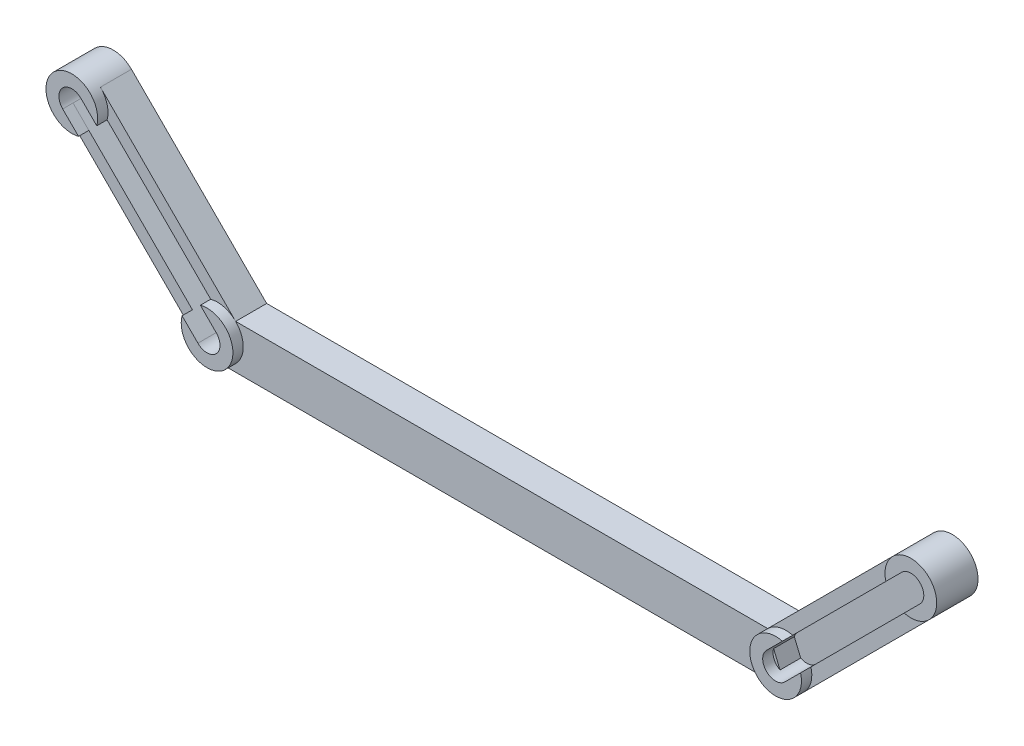
from build123d import *
from build123d.topology import SkipClean

# Parameters (mm, degrees)
SKETCH_1_R            = 5
SKETCH_1_R_2          = 2.5
EXTRUDE_1_DEPTH       = 10
EXTRUDE_1_2_DEPTH     = 10
EXTRUDE_1_3_DEPTH     = 10
EXTRUDE_1_4_DEPTH     = 10
EXTRUDE_2_DEPTH       = 6
CUT_EXTRUDE_1_DEPTH   = 4
EXTRUDE_START         = -2
EXTRUDE_3_OUTLINE_R   = 2.5
EXTRUDE_3_DEPTH       = 2
EXTRUDE_3_2_DEPTH     = 2
EXTRUDE_3_3_OUTLINE_R = 2.5
EXTRUDE_3_3_DEPTH     = 2
CUT_EXTRUDE_2_DEPTH   = 4
CUT_EXTRUDE_6_DEPTH   = 8
EXTRUDE_4_DEPTH       = 6
CUT_EXTRUDE_START     = -2
CUT_EXTRUDE_8_DEPTH   = 2
CUT_EXTRUDE_8_2_DEPTH = 2


with BuildPart() as part:
    # Эскиз1 → Бобышка-Вытянуть1 (new body)
    with BuildSketch(Plane.XY):
        with Locations((-11.277859903, 1.201925786)):
            Circle(SKETCH_1_R)
        with Locations((-11.277859903, 1.201925786)):
            Circle(SKETCH_1_R_2, mode=Mode.SUBTRACT)
    extrude(amount=EXTRUDE_1_DEPTH)



with BuildPart() as body_2:
    # Эскиз1 → Extrude 1 2 (new body)
    with BuildSketch(Plane.XY):
        with Locations((-37.440810807, -24.961025118)):
            Circle(SKETCH_1_R)
        with Locations((-37.440810807, -24.961025118)):
            Circle(SKETCH_1_R_2, mode=Mode.SUBTRACT)
    extrude(amount=EXTRUDE_1_2_DEPTH)


with BuildPart() as body_3:
    # Эскиз1 → Extrude 1 3 (new body)
    with BuildSketch(Plane.XY):
        with Locations((-147.440810807, -24.961025118)):
            Circle(SKETCH_1_R)
        with Locations((-147.440810807, -24.961025118)):
            Circle(SKETCH_1_R_2, mode=Mode.SUBTRACT)
    extrude(amount=EXTRUDE_1_3_DEPTH)


with BuildPart() as body_4:
    # Эскиз1 → Extrude 1 4 (new body)
    with BuildSketch(Plane.XY):
        with Locations((-173.603761711, 1.201925786)):
            Circle(SKETCH_1_R)
        with Locations((-173.603761711, 1.201925786)):
            Circle(SKETCH_1_R_2, mode=Mode.SUBTRACT)
    extrude(amount=EXTRUDE_1_4_DEPTH)


with BuildPart() as part_1:
    add(part.part)

    add(body_2.part)  # Бобышка-Вытянуть2 merges body 2
    # Эскиз3 → Бобышка-Вытянуть2 (add)
    with BuildSketch(Plane(origin=(0, 0, 0), x_dir=(-1, 0, 0), z_dir=(0, 0, -1))):
        Polygon((11.277859903, 1.201925786), (14.813393809, 4.737459692), (40.976344713, -21.425491212), (33.905276901, -28.496559024), (7.742325997, -2.33360812), align=None)
        Polygon((147.440810807, -24.961025118), (143.905276901, -21.425491212), (170.068227805, 4.737459692), (177.139295617, -2.33360812), (150.976344713, -28.496559024), align=None)
    extrude(amount=-EXTRUDE_2_DEPTH)

    # Эскиз4 → Вырез-Вытянуть1 (cut)
    with BuildSketch(Plane.XY.offset(6)):
        Polygon((-13.045626856, 2.969692739), (-9.51009295, -0.565841167), (-35.673043854, -26.728792071), (-39.20857776, -23.193258165), align=None)
    extrude(amount=-CUT_EXTRUDE_1_DEPTH, mode=Mode.SUBTRACT)

    # Extrude 3 2 outline → Extrude 3 2 (add)
    with BuildSketch(Plane(origin=(0, 0, 0), x_dir=(-1, 0, 0), z_dir=(0, 0, -1)).offset(EXTRUDE_START)):
        with BuildLine():
            Line((9.51009295, -0.565841167), (13.045626856, 2.969692739))
            ThreePointArc((13.045626856, 2.969692739), (9.51009295, 2.969692739), (9.51009295, -0.565841167))
        make_face()
        with BuildLine():
            Line((39.20857776, -23.193258165), (35.673043854, -26.728792071))
            ThreePointArc((35.673043854, -26.728792071), (39.20857776, -26.728792071), (39.20857776, -23.193258165))
        make_face()
    extrude(amount=EXTRUDE_3_2_DEPTH)

    # Эскиз4<2> → Вырез-Вытянуть2 (cut)
    with BuildSketch(Plane.XY.offset(6)):
        Polygon((-13.045626856, 2.969692739), (-9.51009295, -0.565841167), (-35.673043854, -26.728792071), (-39.20857776, -23.193258165), align=None)
    extrude(amount=CUT_EXTRUDE_2_DEPTH, mode=Mode.SUBTRACT)


with BuildPart() as body_4_2:
    # Бобышка-Вытянуть3: read off the stored shape, not the designer's step
    # Бобышка-Вытянуть3 outline → Бобышка-Вытянуть3 (new body)
    with BuildSketch(Plane(origin=(0, 0, 0), x_dir=(-1, 0, 0), z_dir=(0, 0, -1)).offset(EXTRUDE_START)):
        with Locations((173.603761711, 1.201925786)):
            Circle(EXTRUDE_3_OUTLINE_R)
    extrude(amount=EXTRUDE_3_DEPTH)


with BuildPart() as body_5:
    # Extrude 3 3 outline → Extrude 3 3 (new body)
    with BuildSketch(Plane(origin=(0, 0, 0), x_dir=(-1, 0, 0), z_dir=(0, 0, -1)).offset(EXTRUDE_START)):
        with Locations((147.440810807, -24.961025118)):
            Circle(EXTRUDE_3_3_OUTLINE_R)
    extrude(amount=EXTRUDE_3_3_DEPTH)


with BuildPart() as cut_extrude_6_tool:
    # Эскиз9 → Вырез-Вытянуть6 (new body)
    with BuildSketch(Plane.XY.offset(10)):
        Polygon((-173.603761711, 1.201925786), (-171.835994758, 2.969692739), (-145.673043854, -23.193258165), (-149.20857776, -26.728792071), (-175.371528664, -0.565841167), align=None)
    extrude(amount=-CUT_EXTRUDE_6_DEPTH)


with BuildPart() as part_2:
    add(part_1.part)

    # Вырез-Вытянуть6: cut by cut_extrude_6_tool
    add(cut_extrude_6_tool.part, mode=Mode.SUBTRACT)



with BuildPart() as body_3_1:
    add(body_3.part)

    # Вырез-Вытянуть6: cut by cut_extrude_6_tool
    add(cut_extrude_6_tool.part, mode=Mode.SUBTRACT)


with BuildPart() as body_4_1:
    add(body_4.part)

    # Вырез-Вытянуть6: cut by cut_extrude_6_tool
    add(cut_extrude_6_tool.part, mode=Mode.SUBTRACT)

    # Вырез-Вытянуть8: read off the stored shape, not the designer's step
    # Вырез-Вытянуть8 outline → Вырез-Вытянуть8 (cut)
    with BuildSketch(Plane.XY.offset(10).offset(CUT_EXTRUDE_START)):
        with BuildLine():
            ThreePointArc((-168.774132579, -0.092169439), (-177.139295617, 4.737459691), (-172.309666485, -3.627703345))
            Line((-172.309666485, -3.627703345), (-175.371528664, -0.565841167))
            ThreePointArc((-175.371528664, -0.565841167), (-175.371528664, 2.969692739), (-171.835994758, 2.969692739))
            Line((-171.835994758, 2.969692739), (-168.774132579, -0.092169439))
        make_face()
    extrude(amount=CUT_EXTRUDE_8_DEPTH, mode=Mode.SUBTRACT)


with BuildPart() as part_3:
    with SkipClean():  # the faces are left unmerged after this step: merging them gives an invalid solid
        add(part_2.part)

        add(body_3_1.part)  # Бобышка-Вытянуть4 merges body 3

        add(body_5.part)  # Бобышка-Вытянуть4 merges body 5
        # Эскиз10 → Бобышка-Вытянуть4 (add)
        with BuildSketch(Plane(origin=(0, 0, 0), x_dir=(-1, 0, 0), z_dir=(0, 0, -1))):
            Polygon((40.976344713, -21.425491212), (143.905276901, -21.425491212), (147.733498282, -29.952451171), (37.440810807, -29.961025118), align=None)
        extrude(amount=-EXTRUDE_4_DEPTH)

    # Cut-Extrude 8 2 outline → Cut-Extrude 8 2 (cut)
    with SkipClean():  # the faces are left unmerged after this step: merging them gives an invalid solid
        with BuildSketch(Plane.XY.offset(10).offset(CUT_EXTRUDE_START)):
            with BuildLine():
                Line((-32.611181676, -23.666929892), (-35.673043854, -26.728792071))
                ThreePointArc((-35.673043854, -26.728792071), (-39.20857776, -26.728792071), (-39.20857776, -23.193258165))
                Line((-39.20857776, -23.193258165), (-36.146715581, -20.131395986))
                ThreePointArc((-36.146715581, -20.131395986), (-40.976344714, -28.496559023), (-32.611181676, -23.666929892))
            make_face()
            with BuildLine():
                Line((-9.51009295, -0.565841167), (-12.571955129, -3.627703345))
                ThreePointArc((-12.571955129, -3.627703345), (-7.742325998, 4.737459693), (-16.107489035, -0.092169439))
                Line((-16.107489035, -0.092169439), (-13.045626856, 2.969692739))
                ThreePointArc((-13.045626856, 2.969692739), (-9.51009295, 2.969692739), (-9.51009295, -0.565841167))
            make_face()
            with BuildLine():
                ThreePointArc((-152.270439938, -23.666929892), (-143.905276901, -28.496559024), (-148.734906032, -20.131395986))
                Line((-148.734906032, -20.131395986), (-145.673043854, -23.193258165))
                ThreePointArc((-145.673043854, -23.193258165), (-145.673043854, -26.728792071), (-149.20857776, -26.728792071))
                Line((-149.20857776, -26.728792071), (-152.270439938, -23.666929892))
            make_face()
        extrude(amount=CUT_EXTRUDE_8_2_DEPTH, mode=Mode.SUBTRACT)


solid = Compound([body_4_2.part, body_4_1.part, part_3.part])
